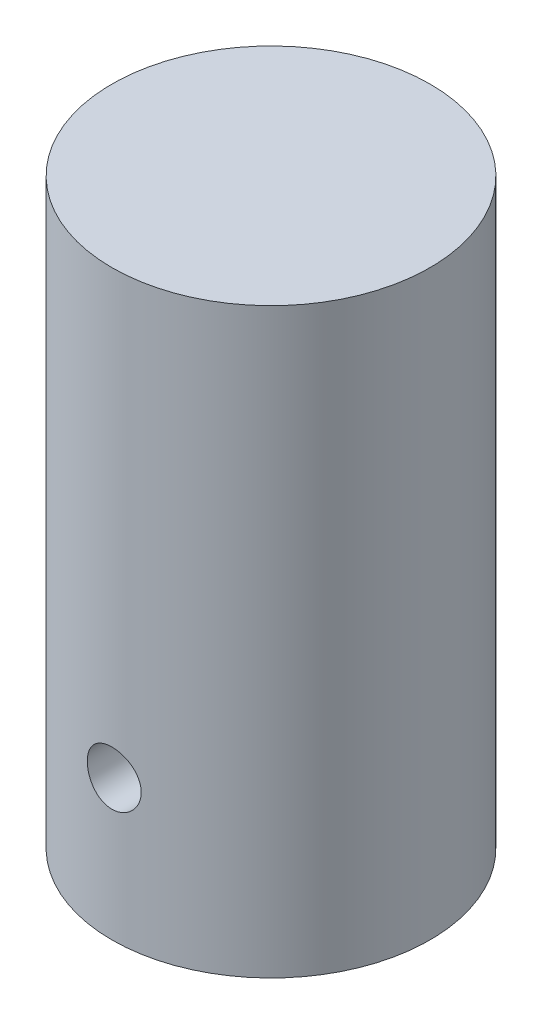
from build123d import *

# Parameters (mm, degrees)
SKETCH1_R           = 37.465
BOSS_EXTRUDE1_DEPTH = 137.16
SKETCH4_R           = 6.35
CUT_EXTRUDE2_DEPTH  = 19.05
SKETCH3_R           = 6.35
CUT_EXTRUDE3_DEPTH  = 19.05


with BuildPart() as part:
    # Sketch1 → Boss-Extrude1 (new body)
    with BuildSketch(Plane(origin=(0, 0, 0), x_dir=(1, 0, 0), z_dir=(0, 1, 0))):
        Circle(SKETCH1_R)
    extrude(amount=BOSS_EXTRUDE1_DEPTH)

    # Sketch4 → Cut-Extrude2 (cut)
    with BuildSketch(Plane.XZ):
        Circle(SKETCH4_R)
    extrude(amount=-CUT_EXTRUDE2_DEPTH, mode=Mode.SUBTRACT)

    # Sketch3 → Cut-Extrude3 (cut)
    with BuildSketch(Plane.XY.offset(37.465)):
        with Locations((0, 33.02)):
            Circle(SKETCH3_R)
    extrude(amount=-CUT_EXTRUDE3_DEPTH, mode=Mode.SUBTRACT)


solid = part.part
